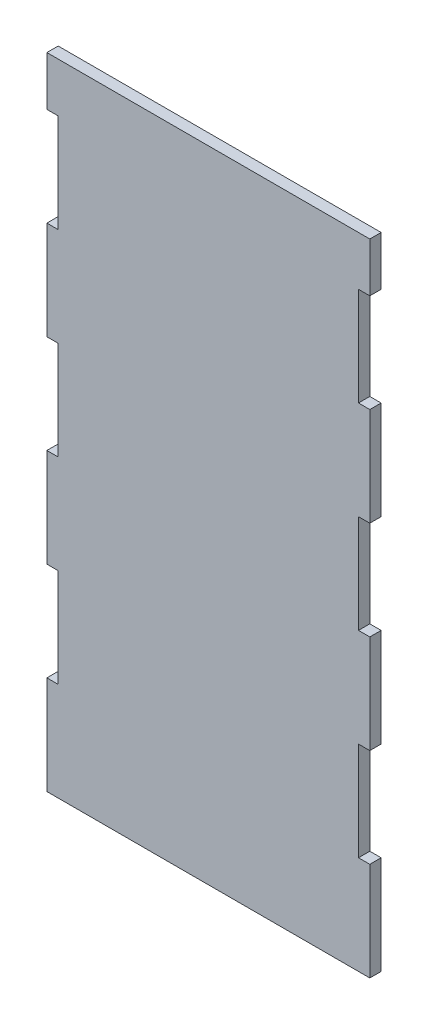
from build123d import *

# Parameters (mm, degrees)
SKETCH1_W           = 83.312
SKETCH1_H           = 165.1
BOSS_EXTRUDE1_DEPTH = 1.4605
SKETCH2_W           = 2.921
SKETCH2_H           = 25.4
CUT_EXTRUDE1_DEPTH  = 2.921


with BuildPart() as part:
    # Sketch1 → Boss-Extrude1 (new, symmetric)
    with BuildSketch(Plane.XY):
        Rectangle(SKETCH1_W, SKETCH1_H)
    extrude(amount=BOSS_EXTRUDE1_DEPTH, both=True)

    # Sketch2 → Cut-Extrude1 (cut)
    with BuildSketch(Plane.XY.offset(1.4605)):
        with Locations((-40.1955, -44.45)):
            Rectangle(SKETCH2_W, SKETCH2_H)
        with Locations((40.1955, -44.45)):
            Rectangle(SKETCH2_W, SKETCH2_H)
        with Locations((-40.1955, 6.35)):
            Rectangle(SKETCH2_W, SKETCH2_H)
        with Locations((40.1955, 6.35)):
            Rectangle(SKETCH2_W, SKETCH2_H)
        with Locations((-40.1955, 57.15)):
            Rectangle(SKETCH2_W, SKETCH2_H)
        with Locations((40.1955, 57.15)):
            Rectangle(SKETCH2_W, SKETCH2_H)
    extrude(amount=-CUT_EXTRUDE1_DEPTH, mode=Mode.SUBTRACT)


solid = part.part
